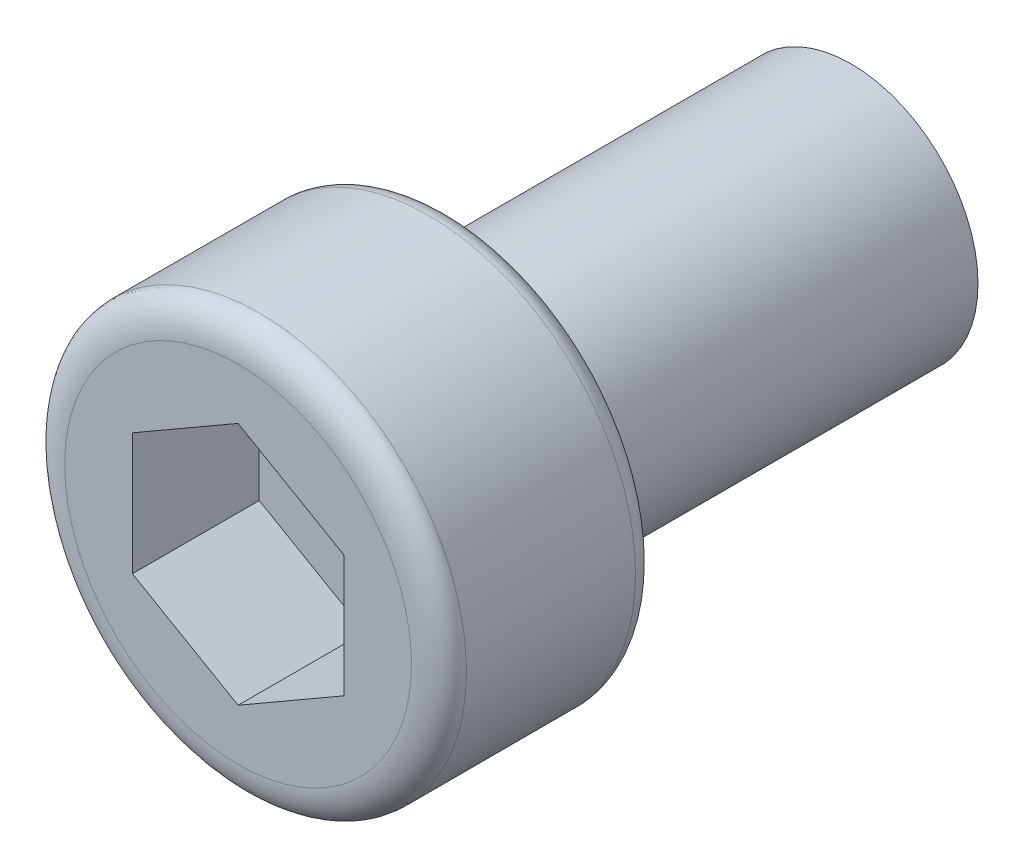
from build123d import *

# Parameters (mm, degrees)
FILLET_1_R          = 0.5
FILLET_2_SIZE       = 0.5
FILLET_2_SIZE_2     = 0.8
CHAMFER_1_SIZE      = 0.5
CHAMFER_1_SIZE2     = 0.866025404
CUT_EXTRUDE_1_DEPTH = 3


with BuildPart() as part:
    # 草图2 → 旋转1 (revolve)
    with BuildSketch(Plane(origin=(0, 0, 0), x_dir=(0, 0, -1), z_dir=(1, 0, 0))):
        Polygon((-7.5, 0), (-7.5, 4.9), (-2.5, 4.9), (-2.5, 3), (7.5, 3), (7.5, 0), align=None)
    revolve(axis=Axis((0, 0, -7.5), (0, 0, 1)))

    # 圆角1
    fillet_1_edges = [part.edges().sort_by_distance(p)[0] for p in [
        (0, -4.9, 2.5),
    ]]
    fillet(fillet_1_edges, radius=FILLET_1_R)

    # 圆角2
    # an asymmetric fillet: 0.8, 0.5 mm, written as the material it takes off along each edge
    with BuildSketch(Plane(origin=(0, 0, 7.5), x_dir=(0, 1, 0), z_dir=(1, 0, 0))) as fillet_2_piece_1:
        with BuildLine():
            Bezier((4.9, -FILLET_2_SIZE), (4.9, 0), (4.9 - FILLET_2_SIZE_2, 0), weights=[1, 0.707106781, 1])
            Line((4.9 - FILLET_2_SIZE_2, 0), (4.9, 0))
            Line((4.9, 0), (4.9, -FILLET_2_SIZE))
        make_face()
    revolve(axis=Axis((0, 0, 7.5), (0, 0, 1)), mode=Mode.SUBTRACT)

    # 倒角1
    chamfer_1_edges = [part.edges().sort_by_distance(p)[0] for p in [
        (0, -3, -7.5),
    ]]
    chamfer_1_side = [part.faces().sort_by_distance(p)[0] for p in [
        (0, -3, -2.5),
    ]]
    chamfer(chamfer_1_edges, length=CHAMFER_1_SIZE, length2=CHAMFER_1_SIZE2, reference=chamfer_1_side[0])

    # 草图3 → 切除-拉伸1 (cut)
    with BuildSketch(Plane.XY.offset(7.5)):
        Polygon((0, 2.886751346), (-2.5, 1.443375673), (-2.5, -1.443375673), (0, -2.886751346), (2.5, -1.443375673), (2.5, 1.443375673), align=None)
    extrude(amount=-CUT_EXTRUDE_1_DEPTH, mode=Mode.SUBTRACT)


solid = part.part
